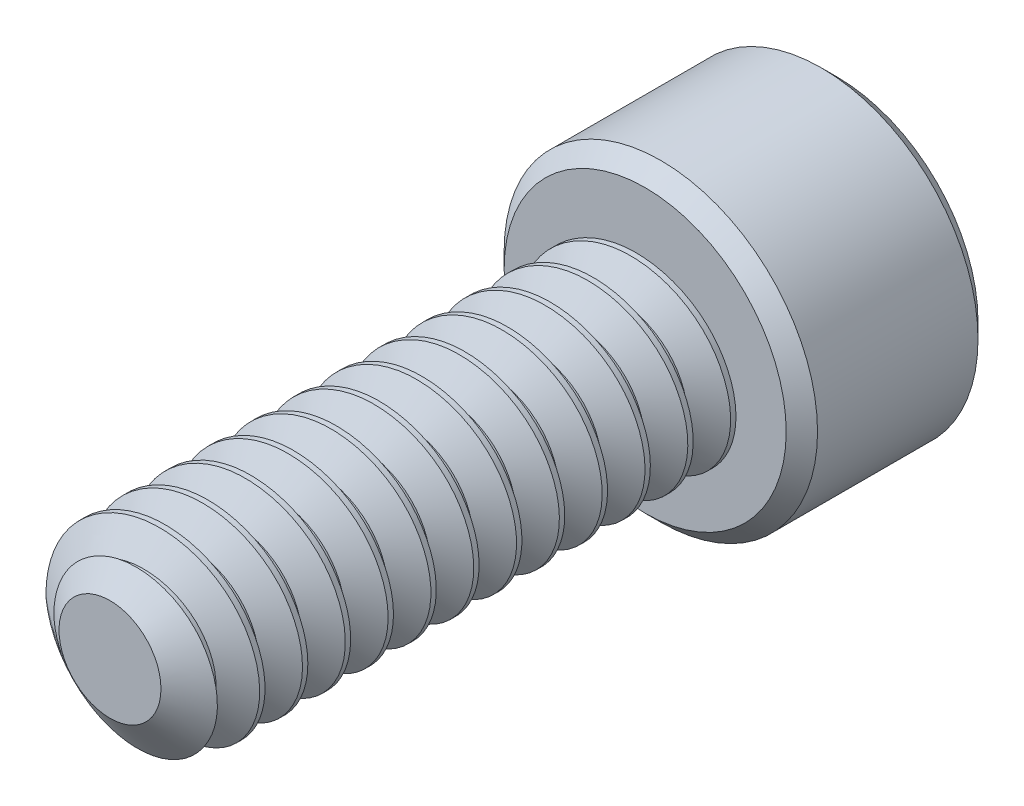
from build123d import *

# Parameters (mm, degrees)
SKETCH1_R          = 1.4224
EXTRUDE1_DEPTH     = 7.9375
CUT_SWEEP1_PITCH   = 0.635
SKETCH6_R          = 2.3241
EXTRUDE2_DEPTH     = 2.8448
CUT_EXTRUDE1_DEPTH = 1.7859375
CHAMFER1_SIZE      = 0.23241


with BuildPart() as part:
    # Sketch1 → Extrude1 (new body)
    with BuildSketch(Plane.XY):
        Circle(SKETCH1_R)
    extrude(amount=-EXTRUDE1_DEPTH)

    # Cut-Sweep1: the profile of Sketch3 profile screwed along a right-hand helix of 13.5 turns, 6 arcs to a turn; built about Z, then put on its axis
    cut_sweep1_z = Axis((0, 0, 0), (0, 0, 1))
    cut_sweep1_corners = [(1.4227, 0, -0.555798205), (1.009955401, 0, -0.3175), (1.009955401, 0, -0.238125), (1.4227, 0, 0.000173205)]
    with BuildLine(mode=Mode.PRIVATE) as cut_sweep1_profile:
        Line(cut_sweep1_corners[0], cut_sweep1_corners[1])
        Line(cut_sweep1_corners[1], cut_sweep1_corners[2])
        Line(cut_sweep1_corners[2], cut_sweep1_corners[3])
        Line(cut_sweep1_corners[3], cut_sweep1_corners[0])
    cut_sweep1_cap = Face(cut_sweep1_profile.wire())
    cut_sweep1_turn_angles = [0, 30, 60, 90, 120, 150, 180, 210, 240, 270, 300, 330, 360]
    cut_sweep1_turn_weights = [1, 0.8660254037844387, 1, 0.8660254037844387, 1, 0.8660254037844387, 1, 0.8660254037844387, 1, 0.8660254037844387, 1, 0.8660254037844387, 1]
    cut_sweep1_turn_rails = [Edge.make_bspline([Vector(p[0], p[1], 0).rotate(cut_sweep1_z, cut_sweep1_turn_angles[k]) / cut_sweep1_turn_weights[k] + Vector(0, 0, p[2] + CUT_SWEEP1_PITCH * cut_sweep1_turn_angles[k] / 360) for k in range(13)], [0, 0, 0, 1, 1, 2, 2, 3, 3, 4, 4, 5, 5, 6, 6, 6], 2, cut_sweep1_turn_weights) for p in cut_sweep1_corners]
    cut_sweep1_turn_sides = [Face.make_surface_from_curves(cut_sweep1_turn_rails[p[0]], cut_sweep1_turn_rails[p[1]]) for p in [(0, 1), (1, 2), (2, 3), (3, 0)]]
    cut_sweep1_last_angles = [4680, 4710, 4740, 4770, 4800, 4830, 4860]
    cut_sweep1_last_weights = [1, 0.8660254037844387, 1, 0.8660254037844387, 1, 0.8660254037843632, 1]
    cut_sweep1_last_rails = [Edge.make_bspline([Vector(p[0], p[1], 0).rotate(cut_sweep1_z, cut_sweep1_last_angles[k]) / cut_sweep1_last_weights[k] + Vector(0, 0, p[2] + CUT_SWEEP1_PITCH * cut_sweep1_last_angles[k] / 360) for k in range(7)], [0, 0, 0, 1, 1, 2, 2, 3, 3, 3], 2, cut_sweep1_last_weights) for p in cut_sweep1_corners]
    cut_sweep1_last_sides = [Face.make_surface_from_curves(cut_sweep1_last_rails[p[0]], cut_sweep1_last_rails[p[1]]) for p in [(0, 1), (1, 2), (2, 3), (3, 0)]]
    cut_sweep1 = Plane(origin=(0, 0, 0), x_dir=(0, 1, 0), z_dir=(0, 0, -1)) * Solid(Shell([*[p.moved(Location((0, 0, CUT_SWEEP1_PITCH * i))) for i in range(13) for p in cut_sweep1_turn_sides], *cut_sweep1_last_sides, cut_sweep1_cap, cut_sweep1_cap.rotate(cut_sweep1_z, 4860).moved(Location((0, 0, CUT_SWEEP1_PITCH * 4860 / 360)))]))
    add(cut_sweep1, mode=Mode.SUBTRACT)

    # Sketch4 → Cut-Revolve1 (revolve, cut)
    with BuildSketch(Plane(origin=(0, 0, 0), x_dir=(0, 0, -1), z_dir=(1, 0, 0)), mode=Mode.PRIVATE) as cut_revolve1_sk:
        Polygon((0.466649532, 1.4224), (0, 0.755955401), (0, 1.4224), align=None)
    revolve(cut_revolve1_sk.sketch.rotate(Axis((0, 0, 0), (0, 0, -1)), 264.795368264), axis=Axis((0, 0, 0), (0, 0, -1)), mode=Mode.SUBTRACT)

    # Sketch6 → Extrude2 (add)
    with BuildSketch(Plane(origin=(0, 0, -7.9375), x_dir=(-1, 0, 0), z_dir=(0, 0, -1))):
        Circle(SKETCH6_R)
    extrude(amount=EXTRUDE2_DEPTH)

    # Sketch7 → Cut-Extrude1 (cut)
    with BuildSketch(Plane(origin=(0, 0, -10.7823), x_dir=(-1, 0, 0), z_dir=(0, 0, -1))):
        Polygon((0, 1.374815329), (-1.190625, 0.687407664), (-1.190625, -0.687407664), (0, -1.374815329), (1.190625, -0.687407664), (1.190625, 0.687407664), align=None)
    extrude(amount=-CUT_EXTRUDE1_DEPTH, mode=Mode.SUBTRACT)

    # Cut-Extrude2 cone 1 section (through the dimple's axis) → Cut-Extrude2 (revolve, cut)
    with BuildSketch(Plane(origin=(0, 0, -10.7823), x_dir=(0, 1, 0), z_dir=(1, 0, 0))):
        Polygon((0, 0), (1.374815329, 0), (0, 1.374815329), align=None)
    revolve(axis=Axis((0, 0, -10.7823), (0, 0, 1)), mode=Mode.SUBTRACT)

    # Chamfer1
    chamfer1_edges = [part.edges().sort_by_distance(p)[0] for p in [
        (2.3241, 0, -7.9375),
        (2.3241, 0, -10.7823),
    ]]
    chamfer(chamfer1_edges, length=CHAMFER1_SIZE)


solid = part.part
